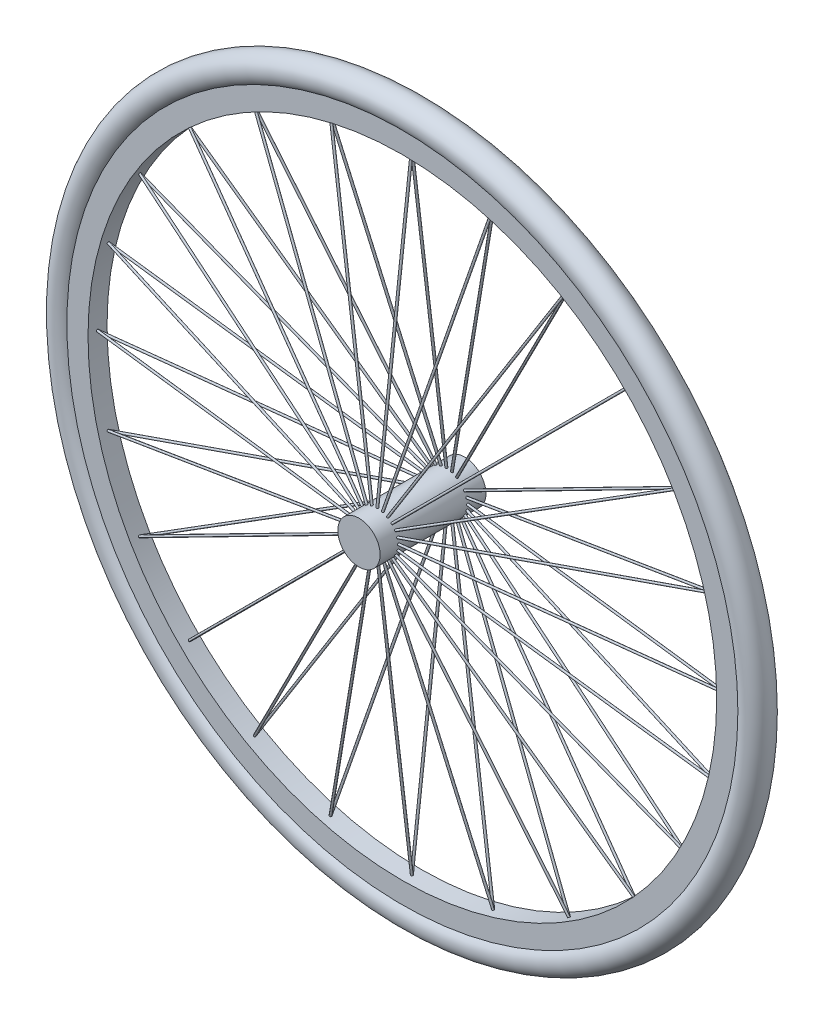
from build123d import *

# Parameters (mm, degrees)
SKETCH_1_R                  = 20
EXTRUDE_1_DEPTH             = 50
EXTRUDE_2_REACH             = 490.288
EXTRUDE_2_END_RADIUS        = 297.143913836
SKETCH_6_R                  = 1
PATTERN_CIRCULAR_1_COUNT    = 24
MIRROR_1_COPY_1_REACH       = 490.288
MIRROR_1_COPY_1_END_RADIUS  = 297.143913836
MIRROR_1_COPY_1_SKETCH_R    = 1
MIRROR_1_COPY_2_REACH       = 490.288
MIRROR_1_COPY_2_END_RADIUS  = 297.143913836
MIRROR_1_COPY_2_SKETCH_R    = 1
MIRROR_1_COPY_3_REACH       = 490.288
MIRROR_1_COPY_3_END_RADIUS  = 297.143913836
MIRROR_1_COPY_3_SKETCH_R    = 1
MIRROR_1_COPY_4_REACH       = 490.288
MIRROR_1_COPY_4_END_RADIUS  = 297.143913836
MIRROR_1_COPY_4_SKETCH_R    = 1
MIRROR_1_COPY_5_REACH       = 490.288
MIRROR_1_COPY_5_END_RADIUS  = 297.143913836
MIRROR_1_COPY_5_SKETCH_R    = 1
MIRROR_1_COPY_6_REACH       = 490.288
MIRROR_1_COPY_6_END_RADIUS  = 297.143913836
MIRROR_1_COPY_6_SKETCH_R    = 1
MIRROR_1_COPY_7_REACH       = 490.288
MIRROR_1_COPY_7_END_RADIUS  = 297.143913836
MIRROR_1_COPY_7_SKETCH_R    = 1
MIRROR_1_COPY_8_REACH       = 490.288
MIRROR_1_COPY_8_END_RADIUS  = 297.143913836
MIRROR_1_COPY_8_SKETCH_R    = 1
MIRROR_1_COPY_9_REACH       = 490.288
MIRROR_1_COPY_9_END_RADIUS  = 297.143913836
MIRROR_1_COPY_9_SKETCH_R    = 1
MIRROR_1_COPY_10_REACH      = 490.288
MIRROR_1_COPY_10_END_RADIUS = 297.143913836
MIRROR_1_COPY_10_SKETCH_R   = 1
MIRROR_1_COPY_11_REACH      = 490.288
MIRROR_1_COPY_11_END_RADIUS = 297.143913836
MIRROR_1_COPY_11_SKETCH_R   = 1
MIRROR_1_COPY_12_REACH      = 490.288
MIRROR_1_COPY_12_END_RADIUS = 297.143913836
MIRROR_1_COPY_12_SKETCH_R   = 1
MIRROR_1_COPY_13_REACH      = 490.288
MIRROR_1_COPY_13_END_RADIUS = 297.143913836
MIRROR_1_COPY_13_SKETCH_R   = 1
MIRROR_1_COPY_14_REACH      = 490.288
MIRROR_1_COPY_14_END_RADIUS = 297.143913836
MIRROR_1_COPY_14_SKETCH_R   = 1
MIRROR_1_COPY_15_REACH      = 490.288
MIRROR_1_COPY_15_END_RADIUS = 297.143913836
MIRROR_1_COPY_15_SKETCH_R   = 1
MIRROR_1_COPY_16_REACH      = 490.288
MIRROR_1_COPY_16_END_RADIUS = 297.143913836
MIRROR_1_COPY_16_SKETCH_R   = 1
MIRROR_1_COPY_17_REACH      = 490.288
MIRROR_1_COPY_17_END_RADIUS = 297.143913836
MIRROR_1_COPY_17_SKETCH_R   = 1
MIRROR_1_COPY_18_REACH      = 490.288
MIRROR_1_COPY_18_END_RADIUS = 297.143913836
MIRROR_1_COPY_18_SKETCH_R   = 1
MIRROR_1_COPY_19_REACH      = 490.288
MIRROR_1_COPY_19_END_RADIUS = 297.143913836
MIRROR_1_COPY_19_SKETCH_R   = 1
MIRROR_1_COPY_20_REACH      = 490.288
MIRROR_1_COPY_20_END_RADIUS = 297.143913836
MIRROR_1_COPY_20_SKETCH_R   = 1
MIRROR_1_COPY_21_REACH      = 490.288
MIRROR_1_COPY_21_END_RADIUS = 297.143913836
MIRROR_1_COPY_21_SKETCH_R   = 1
MIRROR_1_COPY_22_REACH      = 490.288
MIRROR_1_COPY_22_END_RADIUS = 297.143913836
MIRROR_1_COPY_22_SKETCH_R   = 1
MIRROR_1_COPY_23_REACH      = 490.288
MIRROR_1_COPY_23_END_RADIUS = 297.143913836
MIRROR_1_COPY_23_SKETCH_R   = 1
MIRROR_1_COPY_24_REACH      = 490.288
MIRROR_1_COPY_24_END_RADIUS = 297.143913836
MIRROR_1_COPY_24_SKETCH_R   = 1


with BuildPart() as part:
    # 草图1 → 凸台-拉伸1 (new, symmetric)
    with BuildSketch(Plane.XY):
        Circle(SKETCH_1_R)
    extrude(amount=EXTRUDE_1_DEPTH, both=True)



with BuildPart() as body_2:
    # 草图2 → 旋转1 (revolve)
    with BuildSketch(Plane(origin=(0, 0, 0), x_dir=(1, 0, 0), z_dir=(0, 1, 0))):
        with BuildLine():
            Line((297.143913836, 9), (317.143913836, 9))
            ThreePointArc((317.143913836, 9), (340, 0), (317.143913836, -9))
            Line((317.143913836, -9), (297.143913836, -9))
            Line((297.143913836, -9), (297.143913836, 9))
        make_face()
    revolve(axis=Axis((0, 0, 50), (0, 0, -1)))


with BuildPart() as part_1:
    add(part.part)

    add(body_2.part)  # 凸台-拉伸2 merges body 2
    # 凸台-拉伸2: up to this cylinder (the profile starts inside it)
    extrude_2_end = Plane(origin=(0, 0, 35), z_dir=(0, 0, 1)) * Cylinder(EXTRUDE_2_END_RADIUS, 1575.863827673, mode=Mode.PRIVATE)
    # 草图6 → 凸台-拉伸2 (add, up to the surface)
    with BuildSketch(Plane(origin=(0, 0, 35), x_dir=(-0.11697935085130698, 0, -0.9931343471426245), z_dir=(0.9931343471426245, 0, -0.11697935085130698)), mode=Mode.PRIVATE) as extrude_2_sk1:
        Circle(SKETCH_6_R)
    extrude_2_tool1 = extrude(extrude_2_sk1.sketch, amount=EXTRUDE_2_REACH, mode=Mode.PRIVATE) & extrude_2_end
    extrude_2 = extrude_2_tool1.solids().sort_by_distance((0, 0, 35))[0]
    add(extrude_2)

    # 阵列(圆周)1: 凸台-拉伸2 ×24 about axis
    pattern_circular_1_axis = Axis((0, 0, 50), (0, 0, 1))
    for i in range(1, PATTERN_CIRCULAR_1_COUNT):
        add(extrude_2.rotate(pattern_circular_1_axis, i * 360 / PATTERN_CIRCULAR_1_COUNT))

    # 镜向1 copy 1: up to this cylinder (the profile starts inside it)
    mirror_1_copy_1_end = Plane(origin=(0, 0, 35), z_dir=(0, 0, 1)) * Cylinder(MIRROR_1_COPY_1_END_RADIUS, 1575.863827673, mode=Mode.PRIVATE)
    # 镜向1 copy 1 sketch → 镜向1 copy 1 (add, up to the surface)
    with BuildSketch(Plane(origin=(0, 0, -35), x_dir=(-0.11299337612980752, -0.03027648388404802, 0.9931343471426245), z_dir=(0.959294114879794, 0.2570420833859694, 0.11697935085130698)), mode=Mode.PRIVATE) as mirror_1_copy_1_sk1:
        Circle(MIRROR_1_COPY_1_SKETCH_R)
    mirror_1_copy_1_tool1 = extrude(mirror_1_copy_1_sk1.sketch, amount=MIRROR_1_COPY_1_REACH, mode=Mode.PRIVATE) & mirror_1_copy_1_end
    add(mirror_1_copy_1_tool1.solids().sort_by_distance((0, 0, 35))[0])

    # 镜向1 copy 2: up to this cylinder (the profile starts inside it)
    mirror_1_copy_2_end = Plane(origin=(0, 0, 35), z_dir=(0, 0, 1)) * Cylinder(MIRROR_1_COPY_2_END_RADIUS, 1575.863827673, mode=Mode.PRIVATE)
    # 镜向1 copy 2 sketch → 镜向1 copy 2 (add, up to the surface)
    with BuildSketch(Plane(origin=(0, 0, -35), x_dir=(-0.10130708955544465, -0.05848967542565348, 0.9931343471426245), z_dir=(0.8600795739963863, 0.4965671735713122, 0.11697935085130698)), mode=Mode.PRIVATE) as mirror_1_copy_2_sk1:
        Circle(MIRROR_1_COPY_2_SKETCH_R)
    mirror_1_copy_2_tool1 = extrude(mirror_1_copy_2_sk1.sketch, amount=MIRROR_1_COPY_2_REACH, mode=Mode.PRIVATE) & mirror_1_copy_2_end
    add(mirror_1_copy_2_tool1.solids().sort_by_distance((0, 0, 35))[0])

    # 镜向1 copy 3: up to this cylinder (the profile starts inside it)
    mirror_1_copy_3_end = Plane(origin=(0, 0, 35), z_dir=(0, 0, 1)) * Cylinder(MIRROR_1_COPY_3_END_RADIUS, 1575.863827673, mode=Mode.PRIVATE)
    # 镜向1 copy 3 sketch → 镜向1 copy 3 (add, up to the surface)
    with BuildSketch(Plane(origin=(0, 0, -35), x_dir=(-0.0827168922457595, -0.08271689224575948, 0.9931343471426245), z_dir=(0.7022520314938245, 0.7022520314938244, 0.11697935085130698)), mode=Mode.PRIVATE) as mirror_1_copy_3_sk1:
        Circle(MIRROR_1_COPY_3_SKETCH_R)
    mirror_1_copy_3_tool1 = extrude(mirror_1_copy_3_sk1.sketch, amount=MIRROR_1_COPY_3_REACH, mode=Mode.PRIVATE) & mirror_1_copy_3_end
    add(mirror_1_copy_3_tool1.solids().sort_by_distance((0, 0, 35))[0])

    # 镜向1 copy 4: up to this cylinder (the profile starts inside it)
    mirror_1_copy_4_end = Plane(origin=(0, 0, 35), z_dir=(0, 0, 1)) * Cylinder(MIRROR_1_COPY_4_END_RADIUS, 1575.863827673, mode=Mode.PRIVATE)
    # 镜向1 copy 4 sketch → 镜向1 copy 4 (add, up to the surface)
    with BuildSketch(Plane(origin=(0, 0, -35), x_dir=(-0.0584896754256535, -0.10130708955544464, 0.9931343471426245), z_dir=(0.49656717357131236, 0.8600795739963862, 0.11697935085130698)), mode=Mode.PRIVATE) as mirror_1_copy_4_sk1:
        Circle(MIRROR_1_COPY_4_SKETCH_R)
    mirror_1_copy_4_tool1 = extrude(mirror_1_copy_4_sk1.sketch, amount=MIRROR_1_COPY_4_REACH, mode=Mode.PRIVATE) & mirror_1_copy_4_end
    add(mirror_1_copy_4_tool1.solids().sort_by_distance((0, 0, 35))[0])

    # 镜向1 copy 5: up to this cylinder (the profile starts inside it)
    mirror_1_copy_5_end = Plane(origin=(0, 0, 35), z_dir=(0, 0, 1)) * Cylinder(MIRROR_1_COPY_5_END_RADIUS, 1575.863827673, mode=Mode.PRIVATE)
    # 镜向1 copy 5 sketch → 镜向1 copy 5 (add, up to the surface)
    with BuildSketch(Plane(origin=(0, 0, -35), x_dir=(-0.03027648388404802, -0.11299337612980752, 0.9931343471426245), z_dir=(0.2570420833859694, 0.959294114879794, 0.11697935085130698)), mode=Mode.PRIVATE) as mirror_1_copy_5_sk1:
        Circle(MIRROR_1_COPY_5_SKETCH_R)
    mirror_1_copy_5_tool1 = extrude(mirror_1_copy_5_sk1.sketch, amount=MIRROR_1_COPY_5_REACH, mode=Mode.PRIVATE) & mirror_1_copy_5_end
    add(mirror_1_copy_5_tool1.solids().sort_by_distance((0, 0, 35))[0])

    # 镜向1 copy 6: up to this cylinder (the profile starts inside it)
    mirror_1_copy_6_end = Plane(origin=(0, 0, 35), z_dir=(0, 0, 1)) * Cylinder(MIRROR_1_COPY_6_END_RADIUS, 1575.863827673, mode=Mode.PRIVATE)
    # 镜向1 copy 6 sketch → 镜向1 copy 6 (add, up to the surface)
    with BuildSketch(Plane(origin=(0, 0, -35), x_dir=(0, -0.11697935085130698, 0.9931343471426245), z_dir=(0, 0.9931343471426245, 0.11697935085130698)), mode=Mode.PRIVATE) as mirror_1_copy_6_sk1:
        Circle(MIRROR_1_COPY_6_SKETCH_R)
    mirror_1_copy_6_tool1 = extrude(mirror_1_copy_6_sk1.sketch, amount=MIRROR_1_COPY_6_REACH, mode=Mode.PRIVATE) & mirror_1_copy_6_end
    add(mirror_1_copy_6_tool1.solids().sort_by_distance((0, 0, 35))[0])

    # 镜向1 copy 7: up to this cylinder (the profile starts inside it)
    mirror_1_copy_7_end = Plane(origin=(0, 0, 35), z_dir=(0, 0, 1)) * Cylinder(MIRROR_1_COPY_7_END_RADIUS, 1575.863827673, mode=Mode.PRIVATE)
    # 镜向1 copy 7 sketch → 镜向1 copy 7 (add, up to the surface)
    with BuildSketch(Plane(origin=(0, 0, -35), x_dir=(0.030276483884048033, -0.11299337612980752, 0.9931343471426244), z_dir=(-0.2570420833859695, 0.959294114879794, 0.11697935085130697)), mode=Mode.PRIVATE) as mirror_1_copy_7_sk1:
        Circle(MIRROR_1_COPY_7_SKETCH_R)
    mirror_1_copy_7_tool1 = extrude(mirror_1_copy_7_sk1.sketch, amount=MIRROR_1_COPY_7_REACH, mode=Mode.PRIVATE) & mirror_1_copy_7_end
    add(mirror_1_copy_7_tool1.solids().sort_by_distance((0, 0, 35))[0])

    # 镜向1 copy 8: up to this cylinder (the profile starts inside it)
    mirror_1_copy_8_end = Plane(origin=(0, 0, 35), z_dir=(0, 0, 1)) * Cylinder(MIRROR_1_COPY_8_END_RADIUS, 1575.863827673, mode=Mode.PRIVATE)
    # 镜向1 copy 8 sketch → 镜向1 copy 8 (add, up to the surface)
    with BuildSketch(Plane(origin=(0, 0, -35), x_dir=(0.05848967542565346, -0.10130708955544465, 0.9931343471426245), z_dir=(-0.496567173571312, 0.8600795739963863, 0.11697935085130698)), mode=Mode.PRIVATE) as mirror_1_copy_8_sk1:
        Circle(MIRROR_1_COPY_8_SKETCH_R)
    mirror_1_copy_8_tool1 = extrude(mirror_1_copy_8_sk1.sketch, amount=MIRROR_1_COPY_8_REACH, mode=Mode.PRIVATE) & mirror_1_copy_8_end
    add(mirror_1_copy_8_tool1.solids().sort_by_distance((0, 0, 35))[0])

    # 镜向1 copy 9: up to this cylinder (the profile starts inside it)
    mirror_1_copy_9_end = Plane(origin=(0, 0, 35), z_dir=(0, 0, 1)) * Cylinder(MIRROR_1_COPY_9_END_RADIUS, 1575.863827673, mode=Mode.PRIVATE)
    # 镜向1 copy 9 sketch → 镜向1 copy 9 (add, up to the surface)
    with BuildSketch(Plane(origin=(0, 0, -35), x_dir=(0.08271689224575948, -0.0827168922457595, 0.9931343471426245), z_dir=(-0.7022520314938244, 0.7022520314938245, 0.11697935085130698)), mode=Mode.PRIVATE) as mirror_1_copy_9_sk1:
        Circle(MIRROR_1_COPY_9_SKETCH_R)
    mirror_1_copy_9_tool1 = extrude(mirror_1_copy_9_sk1.sketch, amount=MIRROR_1_COPY_9_REACH, mode=Mode.PRIVATE) & mirror_1_copy_9_end
    add(mirror_1_copy_9_tool1.solids().sort_by_distance((0, 0, 35))[0])

    # 镜向1 copy 10: up to this cylinder (the profile starts inside it)
    mirror_1_copy_10_end = Plane(origin=(0, 0, 35), z_dir=(0, 0, 1)) * Cylinder(MIRROR_1_COPY_10_END_RADIUS, 1575.863827673, mode=Mode.PRIVATE)
    # 镜向1 copy 10 sketch → 镜向1 copy 10 (add, up to the surface)
    with BuildSketch(Plane(origin=(0, 0, -35), x_dir=(0.10130708955544465, -0.05848967542565348, 0.9931343471426245), z_dir=(-0.8600795739963863, 0.4965671735713122, 0.11697935085130698)), mode=Mode.PRIVATE) as mirror_1_copy_10_sk1:
        Circle(MIRROR_1_COPY_10_SKETCH_R)
    mirror_1_copy_10_tool1 = extrude(mirror_1_copy_10_sk1.sketch, amount=MIRROR_1_COPY_10_REACH, mode=Mode.PRIVATE) & mirror_1_copy_10_end
    add(mirror_1_copy_10_tool1.solids().sort_by_distance((0, 0, 35))[0])

    # 镜向1 copy 11: up to this cylinder (the profile starts inside it)
    mirror_1_copy_11_end = Plane(origin=(0, 0, 35), z_dir=(0, 0, 1)) * Cylinder(MIRROR_1_COPY_11_END_RADIUS, 1575.863827673, mode=Mode.PRIVATE)
    # 镜向1 copy 11 sketch → 镜向1 copy 11 (add, up to the surface)
    with BuildSketch(Plane(origin=(0, 0, -35), x_dir=(0.1129933761298075, -0.03027648388404805, 0.9931343471426245), z_dir=(-0.9592941148797939, 0.2570420833859697, 0.11697935085130698)), mode=Mode.PRIVATE) as mirror_1_copy_11_sk1:
        Circle(MIRROR_1_COPY_11_SKETCH_R)
    mirror_1_copy_11_tool1 = extrude(mirror_1_copy_11_sk1.sketch, amount=MIRROR_1_COPY_11_REACH, mode=Mode.PRIVATE) & mirror_1_copy_11_end
    add(mirror_1_copy_11_tool1.solids().sort_by_distance((0, 0, 35))[0])

    # 镜向1 copy 12: up to this cylinder (the profile starts inside it)
    mirror_1_copy_12_end = Plane(origin=(0, 0, 35), z_dir=(0, 0, 1)) * Cylinder(MIRROR_1_COPY_12_END_RADIUS, 1575.863827673, mode=Mode.PRIVATE)
    # 镜向1 copy 12 sketch → 镜向1 copy 12 (add, up to the surface)
    with BuildSketch(Plane(origin=(0, 0, -35), x_dir=(0.11697935085130698, 0, 0.9931343471426245), z_dir=(-0.9931343471426245, 0, 0.11697935085130698)), mode=Mode.PRIVATE) as mirror_1_copy_12_sk1:
        Circle(MIRROR_1_COPY_12_SKETCH_R)
    mirror_1_copy_12_tool1 = extrude(mirror_1_copy_12_sk1.sketch, amount=MIRROR_1_COPY_12_REACH, mode=Mode.PRIVATE) & mirror_1_copy_12_end
    add(mirror_1_copy_12_tool1.solids().sort_by_distance((0, 0, 35))[0])

    # 镜向1 copy 13: up to this cylinder (the profile starts inside it)
    mirror_1_copy_13_end = Plane(origin=(0, 0, 35), z_dir=(0, 0, 1)) * Cylinder(MIRROR_1_COPY_13_END_RADIUS, 1575.863827673, mode=Mode.PRIVATE)
    # 镜向1 copy 13 sketch → 镜向1 copy 13 (add, up to the surface)
    with BuildSketch(Plane(origin=(0, 0, -35), x_dir=(0.11299337612980752, 0.030276483884048026, 0.9931343471426244), z_dir=(-0.959294114879794, -0.25704208338596946, 0.11697935085130697)), mode=Mode.PRIVATE) as mirror_1_copy_13_sk1:
        Circle(MIRROR_1_COPY_13_SKETCH_R)
    mirror_1_copy_13_tool1 = extrude(mirror_1_copy_13_sk1.sketch, amount=MIRROR_1_COPY_13_REACH, mode=Mode.PRIVATE) & mirror_1_copy_13_end
    add(mirror_1_copy_13_tool1.solids().sort_by_distance((0, 0, 35))[0])

    # 镜向1 copy 14: up to this cylinder (the profile starts inside it)
    mirror_1_copy_14_end = Plane(origin=(0, 0, 35), z_dir=(0, 0, 1)) * Cylinder(MIRROR_1_COPY_14_END_RADIUS, 1575.863827673, mode=Mode.PRIVATE)
    # 镜向1 copy 14 sketch → 镜向1 copy 14 (add, up to the surface)
    with BuildSketch(Plane(origin=(0, 0, -35), x_dir=(0.10130708955544464, 0.0584896754256535, 0.9931343471426245), z_dir=(-0.8600795739963862, -0.49656717357131236, 0.11697935085130698)), mode=Mode.PRIVATE) as mirror_1_copy_14_sk1:
        Circle(MIRROR_1_COPY_14_SKETCH_R)
    mirror_1_copy_14_tool1 = extrude(mirror_1_copy_14_sk1.sketch, amount=MIRROR_1_COPY_14_REACH, mode=Mode.PRIVATE) & mirror_1_copy_14_end
    add(mirror_1_copy_14_tool1.solids().sort_by_distance((0, 0, 35))[0])

    # 镜向1 copy 15: up to this cylinder (the profile starts inside it)
    mirror_1_copy_15_end = Plane(origin=(0, 0, 35), z_dir=(0, 0, 1)) * Cylinder(MIRROR_1_COPY_15_END_RADIUS, 1575.863827673, mode=Mode.PRIVATE)
    # 镜向1 copy 15 sketch → 镜向1 copy 15 (add, up to the surface)
    with BuildSketch(Plane(origin=(0, 0, -35), x_dir=(0.08271689224575951, 0.08271689224575948, 0.9931343471426245), z_dir=(-0.7022520314938246, -0.7022520314938244, 0.11697935085130698)), mode=Mode.PRIVATE) as mirror_1_copy_15_sk1:
        Circle(MIRROR_1_COPY_15_SKETCH_R)
    mirror_1_copy_15_tool1 = extrude(mirror_1_copy_15_sk1.sketch, amount=MIRROR_1_COPY_15_REACH, mode=Mode.PRIVATE) & mirror_1_copy_15_end
    add(mirror_1_copy_15_tool1.solids().sort_by_distance((0, 0, 35))[0])

    # 镜向1 copy 16: up to this cylinder (the profile starts inside it)
    mirror_1_copy_16_end = Plane(origin=(0, 0, 35), z_dir=(0, 0, 1)) * Cylinder(MIRROR_1_COPY_16_END_RADIUS, 1575.863827673, mode=Mode.PRIVATE)
    # 镜向1 copy 16 sketch → 镜向1 copy 16 (add, up to the surface)
    with BuildSketch(Plane(origin=(0, 0, -35), x_dir=(0.05848967542565354, 0.10130708955544461, 0.9931343471426245), z_dir=(-0.4965671735713127, -0.860079573996386, 0.11697935085130698)), mode=Mode.PRIVATE) as mirror_1_copy_16_sk1:
        Circle(MIRROR_1_COPY_16_SKETCH_R)
    mirror_1_copy_16_tool1 = extrude(mirror_1_copy_16_sk1.sketch, amount=MIRROR_1_COPY_16_REACH, mode=Mode.PRIVATE) & mirror_1_copy_16_end
    add(mirror_1_copy_16_tool1.solids().sort_by_distance((0, 0, 35))[0])

    # 镜向1 copy 17: up to this cylinder (the profile starts inside it)
    mirror_1_copy_17_end = Plane(origin=(0, 0, 35), z_dir=(0, 0, 1)) * Cylinder(MIRROR_1_COPY_17_END_RADIUS, 1575.863827673, mode=Mode.PRIVATE)
    # 镜向1 copy 17 sketch → 镜向1 copy 17 (add, up to the surface)
    with BuildSketch(Plane(origin=(0, 0, -35), x_dir=(0.030276483884048005, 0.11299337612980752, 0.9931343471426245), z_dir=(-0.2570420833859693, -0.959294114879794, 0.11697935085130698)), mode=Mode.PRIVATE) as mirror_1_copy_17_sk1:
        Circle(MIRROR_1_COPY_17_SKETCH_R)
    mirror_1_copy_17_tool1 = extrude(mirror_1_copy_17_sk1.sketch, amount=MIRROR_1_COPY_17_REACH, mode=Mode.PRIVATE) & mirror_1_copy_17_end
    add(mirror_1_copy_17_tool1.solids().sort_by_distance((0, 0, 35))[0])

    # 镜向1 copy 18: up to this cylinder (the profile starts inside it)
    mirror_1_copy_18_end = Plane(origin=(0, 0, 35), z_dir=(0, 0, 1)) * Cylinder(MIRROR_1_COPY_18_END_RADIUS, 1575.863827673, mode=Mode.PRIVATE)
    # 镜向1 copy 18 sketch → 镜向1 copy 18 (add, up to the surface)
    with BuildSketch(Plane(origin=(0, 0, -35), x_dir=(0, 0.11697935085130698, 0.9931343471426245), z_dir=(0, -0.9931343471426245, 0.11697935085130698)), mode=Mode.PRIVATE) as mirror_1_copy_18_sk1:
        Circle(MIRROR_1_COPY_18_SKETCH_R)
    mirror_1_copy_18_tool1 = extrude(mirror_1_copy_18_sk1.sketch, amount=MIRROR_1_COPY_18_REACH, mode=Mode.PRIVATE) & mirror_1_copy_18_end
    add(mirror_1_copy_18_tool1.solids().sort_by_distance((0, 0, 35))[0])

    # 镜向1 copy 19: up to this cylinder (the profile starts inside it)
    mirror_1_copy_19_end = Plane(origin=(0, 0, 35), z_dir=(0, 0, 1)) * Cylinder(MIRROR_1_COPY_19_END_RADIUS, 1575.863827673, mode=Mode.PRIVATE)
    # 镜向1 copy 19 sketch → 镜向1 copy 19 (add, up to the surface)
    with BuildSketch(Plane(origin=(0, 0, -35), x_dir=(-0.030276483884047967, 0.11299337612980753, 0.9931343471426245), z_dir=(0.25704208338596896, -0.9592941148797941, 0.11697935085130698)), mode=Mode.PRIVATE) as mirror_1_copy_19_sk1:
        Circle(MIRROR_1_COPY_19_SKETCH_R)
    mirror_1_copy_19_tool1 = extrude(mirror_1_copy_19_sk1.sketch, amount=MIRROR_1_COPY_19_REACH, mode=Mode.PRIVATE) & mirror_1_copy_19_end
    add(mirror_1_copy_19_tool1.solids().sort_by_distance((0, 0, 35))[0])

    # 镜向1 copy 20: up to this cylinder (the profile starts inside it)
    mirror_1_copy_20_end = Plane(origin=(0, 0, 35), z_dir=(0, 0, 1)) * Cylinder(MIRROR_1_COPY_20_END_RADIUS, 1575.863827673, mode=Mode.PRIVATE)
    # 镜向1 copy 20 sketch → 镜向1 copy 20 (add, up to the surface)
    with BuildSketch(Plane(origin=(0, 0, -35), x_dir=(-0.0584896754256535, 0.10130708955544464, 0.9931343471426245), z_dir=(0.49656717357131236, -0.8600795739963862, 0.11697935085130698)), mode=Mode.PRIVATE) as mirror_1_copy_20_sk1:
        Circle(MIRROR_1_COPY_20_SKETCH_R)
    mirror_1_copy_20_tool1 = extrude(mirror_1_copy_20_sk1.sketch, amount=MIRROR_1_COPY_20_REACH, mode=Mode.PRIVATE) & mirror_1_copy_20_end
    add(mirror_1_copy_20_tool1.solids().sort_by_distance((0, 0, 35))[0])

    # 镜向1 copy 21: up to this cylinder (the profile starts inside it)
    mirror_1_copy_21_end = Plane(origin=(0, 0, 35), z_dir=(0, 0, 1)) * Cylinder(MIRROR_1_COPY_21_END_RADIUS, 1575.863827673, mode=Mode.PRIVATE)
    # 镜向1 copy 21 sketch → 镜向1 copy 21 (add, up to the surface)
    with BuildSketch(Plane(origin=(0, 0, -35), x_dir=(-0.08271689224575948, 0.08271689224575951, 0.9931343471426245), z_dir=(0.7022520314938243, -0.7022520314938246, 0.11697935085130698)), mode=Mode.PRIVATE) as mirror_1_copy_21_sk1:
        Circle(MIRROR_1_COPY_21_SKETCH_R)
    mirror_1_copy_21_tool1 = extrude(mirror_1_copy_21_sk1.sketch, amount=MIRROR_1_COPY_21_REACH, mode=Mode.PRIVATE) & mirror_1_copy_21_end
    add(mirror_1_copy_21_tool1.solids().sort_by_distance((0, 0, 35))[0])

    # 镜向1 copy 22: up to this cylinder (the profile starts inside it)
    mirror_1_copy_22_end = Plane(origin=(0, 0, 35), z_dir=(0, 0, 1)) * Cylinder(MIRROR_1_COPY_22_END_RADIUS, 1575.863827673, mode=Mode.PRIVATE)
    # 镜向1 copy 22 sketch → 镜向1 copy 22 (add, up to the surface)
    with BuildSketch(Plane(origin=(0, 0, -35), x_dir=(-0.10130708955544461, 0.05848967542565354, 0.9931343471426245), z_dir=(0.860079573996386, -0.4965671735713127, 0.11697935085130698)), mode=Mode.PRIVATE) as mirror_1_copy_22_sk1:
        Circle(MIRROR_1_COPY_22_SKETCH_R)
    mirror_1_copy_22_tool1 = extrude(mirror_1_copy_22_sk1.sketch, amount=MIRROR_1_COPY_22_REACH, mode=Mode.PRIVATE) & mirror_1_copy_22_end
    add(mirror_1_copy_22_tool1.solids().sort_by_distance((0, 0, 35))[0])

    # 镜向1 copy 23: up to this cylinder (the profile starts inside it)
    mirror_1_copy_23_end = Plane(origin=(0, 0, 35), z_dir=(0, 0, 1)) * Cylinder(MIRROR_1_COPY_23_END_RADIUS, 1575.863827673, mode=Mode.PRIVATE)
    # 镜向1 copy 23 sketch → 镜向1 copy 23 (add, up to the surface)
    with BuildSketch(Plane(origin=(0, 0, -35), x_dir=(-0.11299337612980752, 0.030276483884048012, 0.9931343471426245), z_dir=(0.959294114879794, -0.25704208338596934, 0.11697935085130698)), mode=Mode.PRIVATE) as mirror_1_copy_23_sk1:
        Circle(MIRROR_1_COPY_23_SKETCH_R)
    mirror_1_copy_23_tool1 = extrude(mirror_1_copy_23_sk1.sketch, amount=MIRROR_1_COPY_23_REACH, mode=Mode.PRIVATE) & mirror_1_copy_23_end
    add(mirror_1_copy_23_tool1.solids().sort_by_distance((0, 0, 35))[0])

    # 镜向1 copy 24: up to this cylinder (the profile starts inside it)
    mirror_1_copy_24_end = Plane(origin=(0, 0, 35), z_dir=(0, 0, 1)) * Cylinder(MIRROR_1_COPY_24_END_RADIUS, 1575.863827673, mode=Mode.PRIVATE)
    # 镜向1 copy 24 sketch → 镜向1 copy 24 (add, up to the surface)
    with BuildSketch(Plane(origin=(0, 0, -35), x_dir=(-0.11697935085130698, 0, 0.9931343471426245), z_dir=(0.9931343471426245, 0, 0.11697935085130698)), mode=Mode.PRIVATE) as mirror_1_copy_24_sk1:
        Circle(MIRROR_1_COPY_24_SKETCH_R)
    mirror_1_copy_24_tool1 = extrude(mirror_1_copy_24_sk1.sketch, amount=MIRROR_1_COPY_24_REACH, mode=Mode.PRIVATE) & mirror_1_copy_24_end
    add(mirror_1_copy_24_tool1.solids().sort_by_distance((0, 0, 35))[0])


solid = part_1.part
